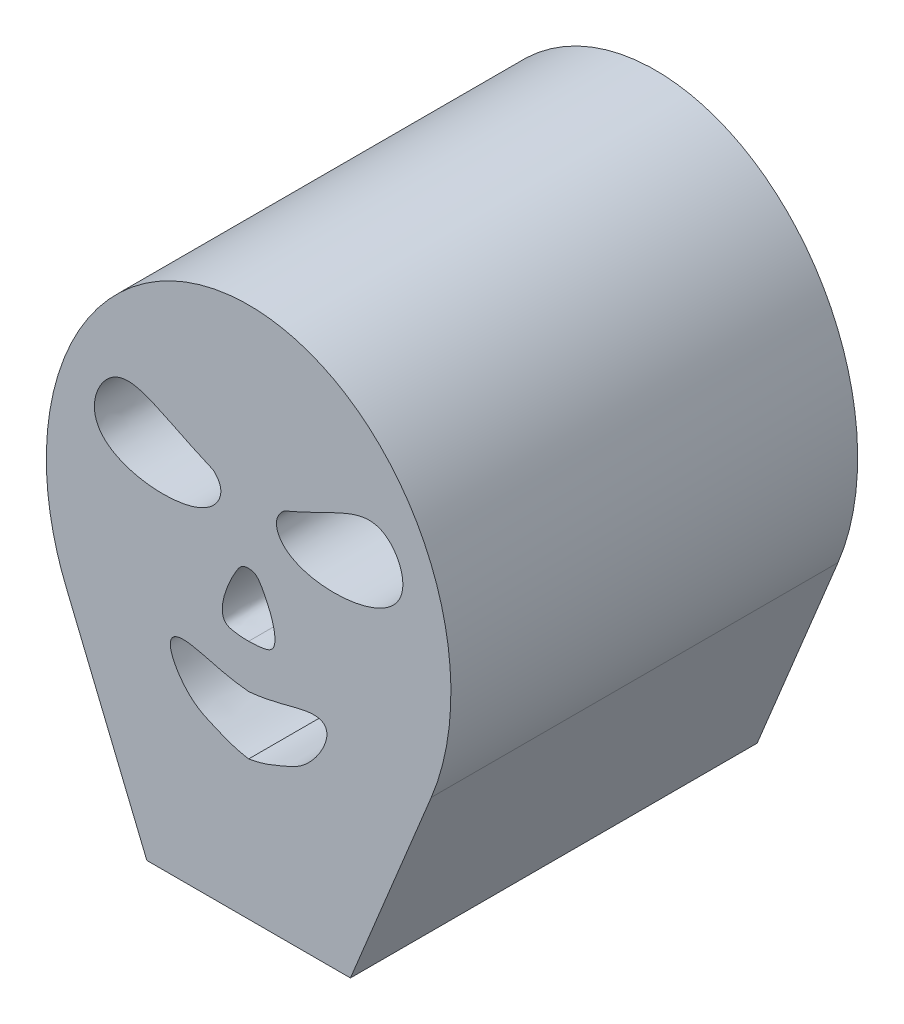
from build123d import *

# Parameters (mm, degrees)
EXTRUDE_1_DEPTH     = 40
SKETCH_2_R          = 1
SKETCH_2_R_2        = 0.950480175
CUT_EXTRUDE_2_DEPTH = 10


# Read off the part's stored shape, not the designer's step: 填料-伸長1
with BuildPart() as part:
    # 填料-伸長1 outline → 填料-伸長1 (new body)
    with BuildSketch(Plane.XY):
        with BuildLine():
            Line((1.947003383, -13.851770636), (9.899248157, 5.504053511))
            add(Edge.make_bspline(
                [(9.899248157, 5.504053511), (23.442583831, 38.468635349), (-8.064642047, 38.468635349), (-39.571867925, 38.468635349), (-26.028532252, 5.504053511)],
                knots=[4.268063936, 4.268063936, 4.268063936, 6.283185307, 6.283185307, 8.298306678, 8.298306678, 8.298306678], degree=2, weights=[1, 0.533924826, 1, 0.533924826, 1]))
            Line((-26.028532252, 5.504053511), (-18.076287478, -13.851770636))
            Line((-18.076287478, -13.851770636), (1.947003383, -13.851770636))
        make_face()
        with BuildLine():
            add(Edge.make_bspline(
                [(-8.064642047, -0.201895434), (-4.436964423, 0.423435317), (-4.681039357, 1.570882518), (-3.315825561, 1.050801072), (-2.470693211, 1.505872338), (-1.625560862, 2.318499597), (-0.715418331, 3.976259207), (3.542748509, 8.591982041), (-1.082917667, 7.58631483), (-2.276730919, 6.904135829), (-4.380116173, 5.880867327), (-8.064642047, 5.539777826)],
                knots=[0, 0, 0, 0, 0, 0, 0, 0, 0, 0, 0, 0, 1, 1, 1, 1, 1, 1, 1, 1, 1, 1, 1, 1], degree=11))
            add(Edge.make_bspline(
                [(-8.064642047, 5.539777826), (-11.749167922, 5.880867327), (-13.852553176, 6.904135829), (-15.046366428, 7.58631483), (-19.672032604, 8.591982041), (-15.413865764, 3.976259207), (-14.503723233, 2.318499597), (-13.658590883, 1.505872338), (-12.813458533, 1.050801072), (-11.448244737, 1.570882518), (-11.692319672, 0.423435317), (-8.064642047, -0.201895434)],
                knots=[0, 0, 0, 0, 0, 0, 0, 0, 0, 0, 0, 0, 1, 1, 1, 1, 1, 1, 1, 1, 1, 1, 1, 1], degree=11))
        make_face(mode=Mode.SUBTRACT)
        with BuildLine():
            add(Edge.make_bspline(
                [(-11.596747137, 22.691539594), (-21.169681488, 26.755009143), (-20.302807984, 28.797235138), (-23.305136378, 25.627856494), (-24.55126704, 22.692156626), (-25.097212624, 19.986475319), (-24.619725674, 18.804653648), (-22.768958366, 18.019049535), (-17.984321299, 16.515321088), (-12.404440151, 16.707631027), (-11.371367649, 18.076761741), (-10.965020694, 19.034055176), (-10.396134957, 20.374265985), (-10.453974767, 21.302639515), (-10.537074266, 21.639187156), (-10.956721406, 21.892635297), (-11.117588771, 22.328663618), (-11.471250313, 22.614495452), (-11.554821814, 22.663741747)],
                knots=[0, 0, 0, 0, 0, 0, 0, 0, 0, 0, 0, 0, 0, 0, 0, 0, 0, 0, 0, 1, 1, 1, 1, 1, 1, 1, 1, 1, 1, 1, 1, 1, 1, 1, 1, 1, 1, 1], degree=18))
            Line((-11.596747137, 22.691539594), (-11.554821814, 22.663741747))
        make_face(mode=Mode.SUBTRACT)
        with BuildLine():
            add(Edge.make_bspline(
                [(-8.064642047, 9.822462332), (-9.305161509, 9.822462332), (-10.178008034, 10.034776352), (-10.366731607, 10.058366798), (-10.55545518, 10.247090371), (-10.956492773, 10.577356624), (-11.003673666, 11.355841362), (-10.69699786, 12.747677713), (-10.201598481, 13.573343345), (-9.52714227, 14.817546116), (-9.129480555, 15.414038688), (-9.129480555, 16.029734199), (-6.999803539, 16.029734199), (-6.999803539, 15.414038688), (-6.602141825, 14.817546116), (-5.927685614, 13.573343345), (-5.432286235, 12.747677713), (-5.125610429, 11.355841362), (-5.172791322, 10.577356624), (-5.573828914, 10.247090371), (-5.762552487, 10.058366798), (-5.95127606, 10.034776352), (-6.824122585, 9.822462332), (-8.064642047, 9.822462332)],
                knots=[0, 0, 0, 0, 0, 0, 0, 0, 0, 0, 0, 0, 0, 1, 1, 1, 1, 1, 1, 1, 1, 1, 1, 1, 2, 2, 2, 2, 2, 2, 2, 2, 2, 2, 2, 2, 2], degree=12))
        make_face(mode=Mode.SUBTRACT)
        with BuildLine():
            add(Edge.make_bspline(
                [(-4.57446228, 22.663741747), (-4.658033782, 22.614495452), (-5.011695323, 22.328663618), (-5.172562689, 21.892635297), (-5.592209828, 21.639187156), (-5.675309327, 21.302639515), (-5.733149138, 20.374265985), (-5.164263401, 19.034055176), (-4.757916446, 18.076761741), (-3.724843944, 16.707631027), (1.855037205, 16.515321088), (6.639674272, 18.019049535), (8.49044158, 18.804653648), (8.967928529, 19.986475319), (8.421982945, 22.692156626), (7.175852283, 25.627856494), (4.173523889, 28.797235138), (5.040397393, 26.755009143), (-4.532536958, 22.691539594)],
                knots=[0, 0, 0, 0, 0, 0, 0, 0, 0, 0, 0, 0, 0, 0, 0, 0, 0, 0, 0, 1, 1, 1, 1, 1, 1, 1, 1, 1, 1, 1, 1, 1, 1, 1, 1, 1, 1, 1], degree=18))
            Line((-4.57446228, 22.663741747), (-4.532536958, 22.691539594))
        make_face(mode=Mode.SUBTRACT)
    extrude(amount=EXTRUDE_1_DEPTH)

    # 草圖2 → 除料-伸長2 (cut)
    with BuildSketch(Plane.XZ.offset(13.851770636)):
        with Locations(Location((-8.064642047, 32, 0), (0, 0, 270))):
            Circle(SKETCH_2_R)
        with Locations(Location((-8.064642047, 8, 0), (0, 0, 270))):
            Circle(SKETCH_2_R)
        with Locations(Location((-15.076287478, 19.864269332, 0), (0, 0, 270))):
            Circle(SKETCH_2_R_2)
        with Locations(Location((-1.052996617, 19.864269332, 0), (0, 0, 270))):
            Circle(SKETCH_2_R_2)
    extrude(amount=-CUT_EXTRUDE_2_DEPTH, mode=Mode.SUBTRACT)


solid = part.part
